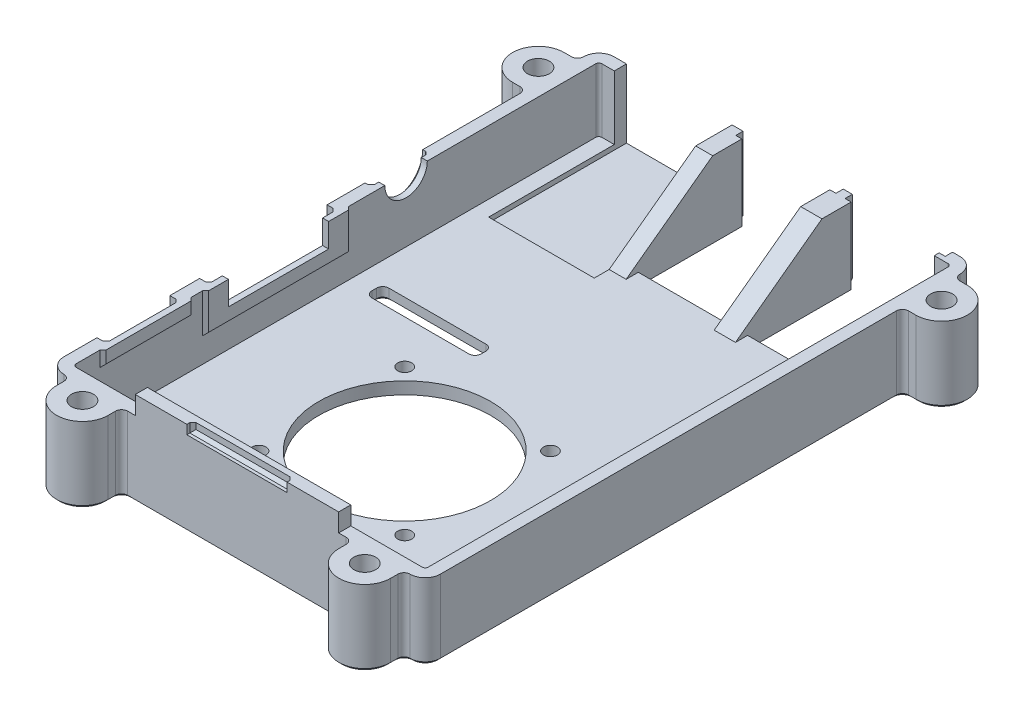
from build123d import *

# Parameters (mm, degrees)
BASE_DEPTH                      = 12.5
SHELL_T                         = -2
CLAMPS_DEPTH                    = 12.5
CLAMP_FILLETS_R                 = 1
SKETCH20_R                      = 1.8
CLAMP_HOLES_DEPTH               = 115.236651299
SKETCH21_R                      = 2.9
CLAMP_COUNTERSINKS_DEPTH        = 3.4
CLAMP_COUNTERSINK_CHAMFERS_SIZE = 0.3
SKETCH22_W                      = 33.5
SKETCH22_H                      = 2
SD_FILL_DEPTH                   = 3
SKETCH23_W                      = 16.5
SKETCH23_H                      = 1.5
SD_APPROACH_DEPTH               = 1
SD_APPROACH_CHAMFER_SIZE        = 0.5
SKETCH24_W                      = 14.5
SKETCH24_H                      = 12.5
USB_CUTOUT_DEPTH                = 18.25
SKETCH25_W                      = 16.5
SKETCH25_H                      = 12.5
USB_APPROACH_DEPTH              = 1.2
USB_INNER_SUPPORT_DEPTH         = 3.5
USB_OUTER_SUPPORT_DEPTH         = 2.8
SKETCH28_W                      = 17.4
SKETCH28_H                      = 11.3
RJ45_CUTOUT_DEPTH               = 22.7
SKETCH29_W                      = 15
SKETCH29_H                      = 2.5
SKETCH29_W_2                    = 24
SKETCH29_H_2                    = 6.43
HDMI_SUPPORT_DEPTH              = 0.5
HDMI_SUPPORT_CHAMFER_SIZE       = 0.5
SKETCH30_W                      = 21
SKETCH30_H                      = 5.93
SKETCH30_W_2                    = 12
SKETCH30_H_2                    = 2
HDMI_APPROACH_DEPTH             = 1.5
SKETCH31_W                      = 16.5
SKETCH31_H                      = 3.93
HDMI_CUTOUT_DEPTH               = 1
HDMI_APPROACH_CHAMFER_SIZE      = 0.5
SKETCH32_R                      = 3.5
AUDIO_CUTOUT_DEPTH              = 2
SKETCH33_R                      = 4.75
AUDIO_APPROACH_DEPTH            = 1
AUDIO_APPROACH_CHAMFER_SIZE     = 0.5
SKETCH34_W                      = 6
SKETCH34_H                      = 52.7
HEADER_CUTOUT_DEPTH             = 2
HEADER_COVER_DEPTH              = 1
SHELL_CHAMFER_SIZE              = 0.5
RIBBON_SLOTS_DEPTH              = 2
SKETCH38_R                      = 14.15
SKETCH38_R_2                    = 1.15
FAN_MOUNT_DEPTH                 = 2
RIBBON_CHAMFERS_SIZE            = 0.5


with BuildPart() as part:
    # Sketch2 → Base (new body)
    with BuildSketch(Plane(origin=(0, 0, 0), x_dir=(1, 0, 0), z_dir=(0, 1, 0))):
        with BuildLine():
            Line((2.5, 0), (59.5, 0))
            ThreePointArc((59.5, 0), (61.267766953, 0.732233047), (62, 2.5))
            Line((62, 2.5), (62, 88.1))
            ThreePointArc((62, 88.1), (61.267766953, 89.867766953), (59.5, 90.6))
            Line((59.5, 90.6), (2.5, 90.6))
            ThreePointArc((2.5, 90.6), (0.732233047, 89.867766953), (0, 88.1))
            Line((0, 88.1), (0, 2.5))
            ThreePointArc((0, 2.5), (0.732233047, 0.732233047), (2.5, 0))
        make_face()
    extrude(amount=BASE_DEPTH)

    # Shell
    shell_openings = [part.faces().sort_by_distance(p)[0] for p in [
        (31, 12.5, -45.3),
    ]]
    offset(amount=SHELL_T, openings=shell_openings, kind=Kind.INTERSECTION)

    # Sketch14 → Clamps (add)
    with BuildSketch(Plane.XZ):
        with BuildLine():
            Line((-2.2, -78.6), (0, -78.6))
            Line((0, -78.6), (0, -87.1))
            Line((0, -87.1), (-2.2, -87.1))
            ThreePointArc((-2.2, -87.1), (-6.45, -82.85), (-2.2, -78.6))
        make_face()
        with BuildLine():
            Line((3.5, 2.2), (3.5, 0))
            Line((3.5, 0), (12, 0))
            Line((12, 0), (12, 2.2))
            ThreePointArc((12, 2.2), (7.75, 6.45), (3.5, 2.2))
        make_face()
        with BuildLine():
            Line((64.2, -78.6), (62, -78.6))
            Line((62, -78.6), (62, -87.1))
            Line((62, -87.1), (64.2, -87.1))
            ThreePointArc((64.2, -87.1), (68.45, -82.85), (64.2, -78.6))
        make_face()
        with BuildLine():
            Line((50, 0), (50, 2.2))
            ThreePointArc((50, 2.2), (54.25, 6.45), (58.5, 2.2))
            Line((58.5, 2.2), (58.5, 0))
            Line((58.5, 0), (50, 0))
        make_face()
    extrude(amount=-CLAMPS_DEPTH)

    # Clamp Fillets
    clamp_fillets_edges = [part.edges().sort_by_distance(p)[0] for p in [
        (0, 6.25, -87.1),
        (0, 6.25, -78.6),
        (3.5, 6.25, 0),
        (12, 6.25, 0),
        (62, 6.25, -78.6),
        (62, 6.25, -87.1),
        (50, 6.25, 0),
        (58.5, 6.25, 0),
    ]]
    fillet(clamp_fillets_edges, radius=CLAMP_FILLETS_R - 0.0001)  # a hair under: the kernel refuses the full size

    # Sketch20 → Clamp Holes (cut, through all)
    with BuildSketch(Plane.XZ):
        with Locations(Location((7.75, 2.2, 0), (0, 0, 270))):
            Circle(SKETCH20_R)
        with Locations(Location((54.25, 2.2, 0), (0, 0, 270))):
            Circle(SKETCH20_R)
        with Locations(Location((64.2, -82.85, 0), (0, 0, 270))):
            Circle(SKETCH20_R)
        with Locations(Location((-2.2, -82.85, 0), (0, 0, 270))):
            Circle(SKETCH20_R)
    extrude(amount=-CLAMP_HOLES_DEPTH, mode=Mode.SUBTRACT)

    # Sketch21 → Clamp Countersinks (cut)
    with BuildSketch(Plane.XZ):
        with Locations(Location((7.75, 2.2, 0), (0, 0, 270))):
            Circle(SKETCH21_R)
        with Locations(Location((54.25, 2.2, 0), (0, 0, 270))):
            Circle(SKETCH21_R)
        with Locations(Location((64.2, -82.85, 0), (0, 0, 270))):
            Circle(SKETCH21_R)
        with Locations(Location((-2.2, -82.85, 0), (0, 0, 270))):
            Circle(SKETCH21_R)
    extrude(amount=-CLAMP_COUNTERSINKS_DEPTH, mode=Mode.SUBTRACT)

    # Clamp Countersink Chamfers
    clamp_countersink_chamfers_edges = [part.edges().sort_by_distance(p)[0] for p in [
        (-2.2, 0, -79.95),
        (64.2, 0, -79.95),
        (54.25, 0, 5.1),
        (7.75, 0, 5.1),
    ]]
    chamfer(clamp_countersink_chamfers_edges, length=CLAMP_COUNTERSINK_CHAMFERS_SIZE)

    # Sketch22 → SD Fill (add)
    with BuildSketch(Plane(origin=(0, 12.5, 0), x_dir=(1, 0, 0), z_dir=(0, 1, 0))):
        with Locations((31, 1)):
            Rectangle(SKETCH22_W, SKETCH22_H)
    extrude(amount=SD_FILL_DEPTH)

    # Sketch23 → SD Approach (cut)
    with BuildSketch(Plane.XY):
        with Locations((31, 14.75)):
            Rectangle(SKETCH23_W, SKETCH23_H)
    extrude(amount=-SD_APPROACH_DEPTH, mode=Mode.SUBTRACT)

    # SD Approach Chamfer
    sd_approach_chamfer_edges = [part.edges().sort_by_distance(p)[0] for p in [
        (22.75, 14.75, -1),
        (39.25, 14.75, -1),
        (31, 14, -1),
    ]]
    chamfer(sd_approach_chamfer_edges, length=SD_APPROACH_CHAMFER_SIZE)

    # Sketch24 → USB Cutout (cut)
    with BuildSketch(Plane(origin=(0, 0, -90.6), x_dir=(-1, 0, 0), z_dir=(0, 0, -1))):
        with Locations((-50, 6.25)):
            Rectangle(SKETCH24_W, SKETCH24_H)
        with Locations((-32, 6.25)):
            Rectangle(SKETCH24_W, SKETCH24_H)
    extrude(amount=-USB_CUTOUT_DEPTH, mode=Mode.SUBTRACT)

    # Sketch25 → USB Approach (cut)
    with BuildSketch(Plane(origin=(0, 0, -90.6), x_dir=(-1, 0, 0), z_dir=(0, 0, -1))):
        with Locations((-50, 6.25)):
            Rectangle(SKETCH25_W, SKETCH25_H)
        with Locations((-32, 6.25)):
            Rectangle(SKETCH25_W, SKETCH25_H)
    extrude(amount=-USB_APPROACH_DEPTH, mode=Mode.SUBTRACT)

    # Sketch26 → USB Inner Support (add)
    with BuildSketch(Plane(origin=(42.75, 0, 0), x_dir=(0, 0, -1), z_dir=(1, 0, 0))):
        Polygon((88.6, 2), (88.6, 12.5), (84.6, 12.5), (70.35, 2), align=None)
    extrude(amount=-USB_INNER_SUPPORT_DEPTH)

    # Sketch27 → USB Outer Support (add)
    with BuildSketch(Plane(origin=(24.75, 0, 0), x_dir=(0, 0, -1), z_dir=(1, 0, 0))):
        Polygon((88.6, 2), (88.6, 12.5), (84.6, 12.5), (70.35, 2), align=None)
    extrude(amount=-USB_OUTER_SUPPORT_DEPTH)

    # Sketch28 → RJ45 Cutout (cut)
    with BuildSketch(Plane(origin=(0, 0, -90.6), x_dir=(-1, 0, 0), z_dir=(0, 0, -1))):
        with Locations((-13.25, 6.85)):
            Rectangle(SKETCH28_W, SKETCH28_H)
    extrude(amount=-RJ45_CUTOUT_DEPTH, mode=Mode.SUBTRACT)

    # Sketch29 → HDMI Support (add)
    with BuildSketch(Plane(origin=(2, 0, 0), x_dir=(0, 0, -1), z_dir=(1, 0, 0))):
        with Locations((13.95, 11.25)):
            Rectangle(SKETCH29_W, SKETCH29_H)
        with Locations((35.35, 9.285)):
            Rectangle(SKETCH29_W_2, SKETCH29_H_2)
    extrude(amount=HDMI_SUPPORT_DEPTH)

    # HDMI Support Chamfer
    hdmi_support_chamfer_edges = [part.edges().sort_by_distance(p)[0] for p in [
        (2.5, 9.285, -47.35),
        (2.5, 6.07, -35.35),
        (2.5, 9.285, -23.35),
        (2.5, 11.25, -21.45),
        (2.5, 10, -13.95),
        (2.5, 11.25, -6.45),
    ]]
    chamfer(hdmi_support_chamfer_edges, length=HDMI_SUPPORT_CHAMFER_SIZE - 0.0001)  # a hair under: the kernel refuses the full size

    # Sketch30 → HDMI Approach (cut)
    with BuildSketch(Plane.ZY):
        with Locations((-35.35, 9.535)):
            Rectangle(SKETCH30_W, SKETCH30_H)
        with Locations((-13.95, 11.5)):
            Rectangle(SKETCH30_W_2, SKETCH30_H_2)
    extrude(amount=-HDMI_APPROACH_DEPTH, mode=Mode.SUBTRACT)

    # Sketch31 → HDMI Cutout (cut)
    with BuildSketch(Plane.ZY.offset(-1.5)):
        with Locations((-35.35, 10.535)):
            Rectangle(SKETCH31_W, SKETCH31_H)
    extrude(amount=-HDMI_CUTOUT_DEPTH, mode=Mode.SUBTRACT)

    # HDMI Approach Chamfer
    hdmi_approach_chamfer_edges = [part.edges().sort_by_distance(p)[0] for p in [
        (1.5, 9.535, -24.85),
        (1.5, 6.57, -35.35),
        (1.5, 9.535, -45.85),
        (1.5, 11.5, -19.95),
        (1.5, 11.5, -7.95),
        (1.5, 10.5, -13.95),
    ]]
    chamfer(hdmi_approach_chamfer_edges, length=HDMI_APPROACH_CHAMFER_SIZE)

    # Sketch32 → Audio Cutout (cut)
    with BuildSketch(Plane.ZY):
        with Locations((-56.85, 12.5)):
            Circle(SKETCH32_R)
    extrude(amount=-AUDIO_CUTOUT_DEPTH, mode=Mode.SUBTRACT)

    # Sketch33 → Audio Approach (cut)
    with BuildSketch(Plane.ZY):
        with Locations((-56.85, 12.5)):
            Circle(SKETCH33_R)
    extrude(amount=-AUDIO_APPROACH_DEPTH, mode=Mode.SUBTRACT)

    # Audio Approach Chamfer
    audio_approach_chamfer_edges = [part.edges().sort_by_distance(p)[0] for p in [
        (1, 7.75, -56.85),
    ]]
    chamfer(audio_approach_chamfer_edges, length=AUDIO_APPROACH_CHAMFER_SIZE)

    # Sketch34 → Header Cutout (cut)
    with BuildSketch(Plane.XZ):
        with Locations((55.5, -35.75)):
            Rectangle(SKETCH34_W, SKETCH34_H)
    extrude(amount=-HEADER_CUTOUT_DEPTH, mode=Mode.SUBTRACT)

    # Sketch35 → Header Cover (add)
    with BuildSketch(Plane.XZ):
        Polygon((56, -9.4), (55, -9.4), (55, -10.4), (53.5, -10.4), (53.5, -15.3625), (52.5, -15.3625), (52.5, -16.3625), (53.5, -16.3625), (53.5, -28.2875), (52.5, -28.2875), (52.5, -29.2875), (53.5, -29.2875), (53.5, -34.25), (55, -34.25), (55, -35.25), (52.5, -35.25), (52.5, -36.25), (55, -36.25), (55, -37.25), (53.5, -37.25), (53.5, -42.2125), (52.5, -42.2125), (52.5, -43.2125), (53.5, -43.2125), (53.5, -55.1375), (52.5, -55.1375), (52.5, -56.1375), (53.5, -56.1375), (53.5, -61.1), (55, -61.1), (55, -62.1), (56, -62.1), (56, -61.1), (57.5, -61.1), (57.5, -56.1375), (58.5, -56.1375), (58.5, -55.1375), (57.5, -55.1375), (57.5, -43.2125), (58.5, -43.2125), (58.5, -42.2125), (57.5, -42.2125), (57.5, -37.25), (56, -37.25), (56, -36.25), (58.5, -36.25), (58.5, -35.25), (56, -35.25), (56, -34.25), (57.5, -34.25), (57.5, -29.2875), (58.5, -29.2875), (58.5, -28.2875), (57.5, -28.2875), (57.5, -16.3625), (58.5, -16.3625), (58.5, -15.3625), (57.5, -15.3625), (57.5, -10.4), (56, -10.4), align=None)
    extrude(amount=-HEADER_COVER_DEPTH)

    # Shell Chamfer
    shell_chamfer_edges = [part.edges().sort_by_distance(p)[0] for p in [
        (-1.59995, 0, -78.6),
        (63.59995, 0, -87.1),
        (49.707136071, 0, 0.292863929),
        (0.732233047, 0, -0.732233047),
        (58.792863929, 0, 0.292863929),
        (12.292863929, 0, 0.292863929),
        (3.207136071, 0, 0.292863929),
        (-0.292863929, 0, -87.392863929),
        (-0.292863929, 0, -78.307136071),
        (62.292863929, 0, -78.307136071),
        (62.292863929, 0, -87.392863929),
        (13.125, 0, -90.6),
        (41, 0, -90.6),
        (-6.45, 0, -82.85),
        (-1.59995, 0, -87.1),
        (7.75, 0, 6.45),
        (3.5, 0, 1.59995),
        (52.5, 0, -12.38125),
        (53.75, 0, -62.1),
        (58.5, 0, -59.11875),
        (57.25, 0, -9.4),
        (57.25, 0, -62.1),
        (58.5, 0, -49.175),
        (58.5, 0, -39.23125),
        (58.5, 0, -32.26875),
        (58.5, 0, -22.325),
        (58.5, 0, -12.38125),
        (53.75, 0, -9.4),
        (52.5, 0, -22.325),
        (52.5, 0, -32.26875),
        (52.5, 0, -39.23125),
        (52.5, 0, -49.175),
        (52.5, 0, -59.11875),
        (68.45, 0, -82.85),
        (63.59995, 0, -78.6),
        (54.25, 0, 6.45),
        (50, 0, 1.59995),
        (0.732233047, 0, -89.867766953),
        (58.875, 0, -90.6),
        (61.267766953, 0, -89.867766953),
        (31, 0, 0),
        (62, 0, -40.05005),
        (58.5, 0, 1.59995),
        (12, 0, 1.59995),
        (61.267766953, 0, -0.732233047),
        (0, 0, -40.05005),
    ]]
    chamfer(shell_chamfer_edges, length=SHELL_CHAMFER_SIZE)

    # Sketch36 → Ribbon Slots (cut)
    with BuildSketch(Plane.XZ):
        with BuildLine():
            Line((23.1, -5.7), (39.1, -5.7))
            ThreePointArc((39.1, -5.7), (39.807106781, -5.992893219), (40.1, -6.7))
            Line((40.1, -6.7), (40.1, -7.5))
            ThreePointArc((40.1, -7.5), (39.807106781, -8.207106781), (39.1, -8.5))
            Line((39.1, -8.5), (23.1, -8.5))
            ThreePointArc((23.1, -8.5), (22.392893219, -8.207106781), (22.1, -7.5))
            Line((22.1, -7.5), (22.1, -6.7))
            ThreePointArc((22.1, -6.7), (22.392893219, -5.992893219), (23.1, -5.7))
        make_face()
        with BuildLine():
            Line((6.45, -46.76), (22.45, -46.76))
            ThreePointArc((22.45, -46.76), (23.157106781, -47.052893219), (23.45, -47.76))
            Line((23.45, -47.76), (23.45, -48.56))
            ThreePointArc((23.45, -48.56), (23.157106781, -49.267106781), (22.45, -49.56))
            Line((22.45, -49.56), (6.45, -49.56))
            ThreePointArc((6.45, -49.56), (5.742893219, -49.267106781), (5.45, -48.56))
            Line((5.45, -48.56), (5.45, -47.76))
            ThreePointArc((5.45, -47.76), (5.742893219, -47.052893219), (6.45, -46.76))
        make_face()
    extrude(amount=-RIBBON_SLOTS_DEPTH, mode=Mode.SUBTRACT)

    # Sketch38 → Fan Mount (cut)
    with BuildSketch(Plane.XZ):
        with Locations(Location((31, -27.63, 0), (0, 0, 270))):
            Circle(SKETCH38_R)
        with Locations(Location((43.000026341, -15.629973659, 0), (0, 0, 270))):
            Circle(SKETCH38_R_2)
        with Locations(Location((43.000026341, -39.630026341, 0), (0, 0, 270))):
            Circle(SKETCH38_R_2)
        with Locations(Location((18.999973659, -15.629973659, 0), (0, 0, 90))):
            Circle(SKETCH38_R_2)
        with Locations(Location((18.999973659, -39.630026341, 0), (0, 0, 90))):
            Circle(SKETCH38_R_2)
    extrude(amount=-FAN_MOUNT_DEPTH, mode=Mode.SUBTRACT)

    # Ribbon Chamfers
    ribbon_chamfers_edges = [part.edges().sort_by_distance(p)[0] for p in [
        (22.392893219, 0, -8.207106781),
        (31.1, 0, -8.5),
        (39.807106781, 0, -8.207106781),
        (40.1, 0, -7.1),
        (39.807106781, 0, -5.992893219),
        (31.1, 0, -5.7),
        (22.392893219, 0, -5.992893219),
        (22.1, 0, -7.1),
        (5.742893219, 0, -49.267106781),
        (14.45, 0, -49.56),
        (23.157106781, 0, -49.267106781),
        (23.45, 0, -48.16),
        (23.157106781, 0, -47.052893219),
        (14.45, 0, -46.76),
        (5.742893219, 0, -47.052893219),
        (5.45, 0, -48.16),
    ]]
    chamfer(ribbon_chamfers_edges, length=RIBBON_CHAMFERS_SIZE)


solid = part.part
